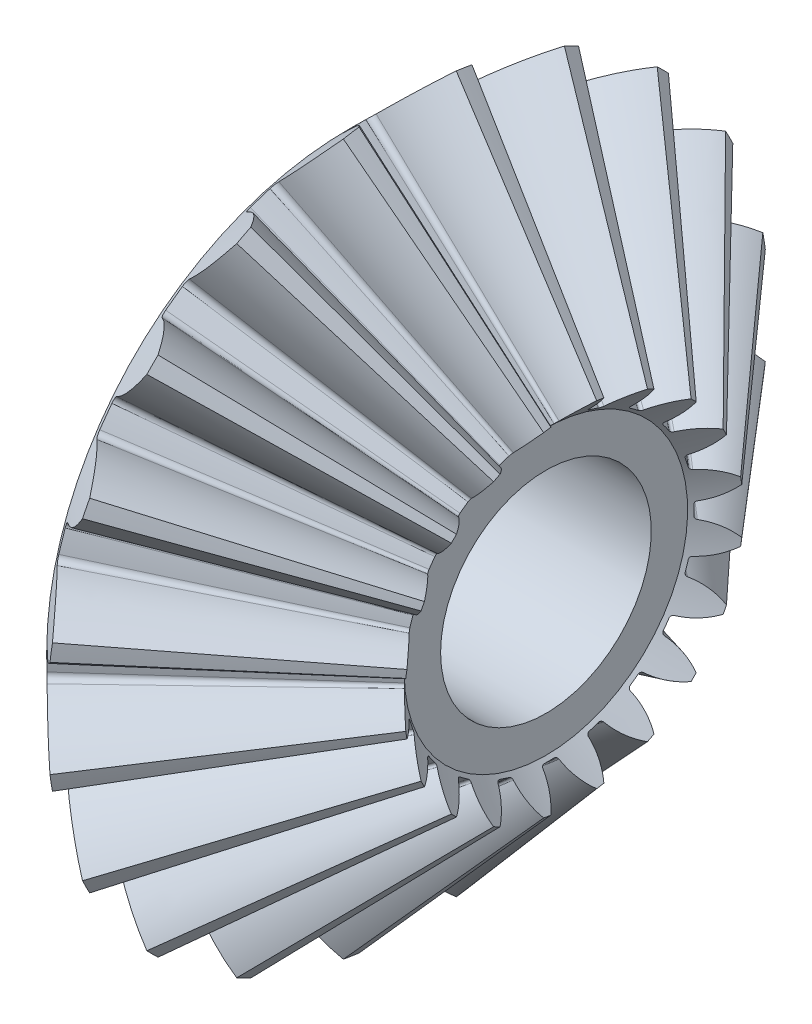
from build123d import *

# Parameters (mm, degrees)
TEETHCUTS_COUNT = 20
TEETHCUTS_ANGLE = 342
HUBSKE_R        = 5
HUB_DEPTH       = 0.0001016
BORSKE_R        = 2.5
BORE_DEPTH      = 8.84097754


with BuildPart() as part:
    # BasProSke → Base-Revolve (revolve)
    with BuildSketch(Plane(origin=(0, 0, 0), x_dir=(1, 0, 0), z_dir=(0, 1, 0)), mode=Mode.PRIVATE) as base_revolve_sk:
        Polygon((0, 0), (0, 7.159073261), (1.406612166, 8.565685424), (5.349252849, 4.023044734), (4.688609434, 3.36240132), (4.688609434, 0), align=None)
    revolve(base_revolve_sk.sketch.rotate(Axis((-10, 0, 0), (1, 0, 0)), 180), axis=Axis((-10, 0, 0), (1, 0, 0)))

    # ToothCut: read off the stored shape, not the designer's step
    # ToothCut: loft between two sections, ruled curve by curve
    toothcut_from = [
        Edge.make_bspline([(8.846968182, 0.006041442, -0.009396371), (8.842747294, 0.001820554, -0.014824058), (8.837070599, -0.003856141, -0.014022911), (8.833691402, -0.007235338, -0.007522631)], [0, 0, 0, 0, 1, 1, 1, 1], 3, [1, 0.779607321, 0.779607321, 1]),
        Edge.make_bspline([(8.833691402, -0.007235338, 0.007522631), (8.837070599, -0.003856141, 0.014022911), (8.842747294, 0.001820554, 0.014824058), (8.846968182, 0.006041442, 0.009396371)], [0, 0, 0, 0, 1, 1, 1, 1], 3, [1, 0.779607321, 0.779607321, 1]),
        Edge.make_bspline([(8.833691402, -0.007235338, -0.007522631), (8.833188772, -0.007737968, -0.006555763), (8.832787408, -0.008139332, -0.005498444), (8.832495307, -0.008431433, -0.00437174)], [0, 0, 0, 0, 1, 1, 1, 1], 3, [1, 0.993359051, 0.993359051, 1]),
        Edge.make_bspline([(8.832495307, -0.008431433, 0.00437174), (8.832787408, -0.008139332, 0.005498444), (8.833188772, -0.007737968, 0.006555763), (8.833691402, -0.007235338, 0.007522631)], [0, 0, 0, 0, 1, 1, 1, 1], 3, [1, 0.993359051, 0.993359051, 1]),
        Edge.make_bspline([(8.832495307, -0.008431433, -0.00437174), (8.831755763, -0.009170977, -0.001519142), (8.831755763, -0.009170977, 0.001519142), (8.832495307, -0.008431433, 0.00437174)], [0, 0, 0, 0, 1, 1, 1, 1], 3, [1, 0.959256539, 0.959256539, 1]),
        Edge.make_line((8.846968182, 0.006041442, 0.009396371), (8.846968182, 0.006041442, -0.009396371)),
    ]
    toothcut_to = [
        Edge.make_bspline([(1.46556069, 8.624633948, -1.28623016), (1.133128031, 8.29220129, -0.817842922), (0.716323315, 7.875396575, -0.512954078), (0.25391972, 7.412992981, -0.399925851)], [0, 0, 0, 0, 1, 1, 1, 1], 3, [1, 0.968991732, 0.968991732, 1]),
        Edge.make_bspline([(0.25391972, 7.412992981, 0.399925851), (0.716323315, 7.875396575, 0.512954078), (1.133128031, 8.29220129, 0.817842922), (1.46556069, 8.624633948, 1.28623016)], [0, 0, 0, 0, 1, 1, 1, 1], 3, [1, 0.968991732, 0.968991732, 1]),
        Edge.make_bspline([(0.25391972, 7.412992981, -0.399925851), (0.198607772, 7.357681033, -0.386405603), (0.16320738, 7.322280641, -0.324800046), (0.165162164, 7.324235425, -0.245465452)], [0, 0, 0, 0, 1, 1, 1, 1], 3, [1, 0.835749277, 0.835749277, 1]),
        Edge.make_bspline([(0.165162164, 7.324235425, 0.245465452), (0.16320738, 7.322280641, 0.324800046), (0.198607772, 7.357681033, 0.386405603), (0.25391972, 7.412992981, 0.399925851)], [0, 0, 0, 0, 1, 1, 1, 1], 3, [1, 0.835749277, 0.835749277, 1]),
        Edge.make_bspline([(0.165162164, 7.324235425, -0.245465452), (0.169193484, 7.328266745, -0.081854918), (0.169193484, 7.328266745, 0.081854918), (0.165162164, 7.324235425, 0.245465452)], [0, 0, 0, 0, 1, 1, 1, 1], 3, [1, 0.999595624, 0.999595624, 1]),
        Edge.make_line((1.46556069, 8.624633948, 1.28623016), (1.46556069, 8.624633948, -1.28623016)),
    ]
    toothcut = Solid(Shell([*[Face.make_surface_from_curves(toothcut_from[k], toothcut_to[k]) for k in range(6)], Face(Wire(toothcut_from)), Face(Wire(toothcut_to))]))
    add(toothcut, mode=Mode.SUBTRACT)

    # TeethCuts: ToothCut ×20 about axis
    teethcuts_axis = Axis((-10, 0, 0), (1, 0, 0))
    for i in range(1, TEETHCUTS_COUNT):
        add(toothcut.rotate(teethcuts_axis, i * TEETHCUTS_ANGLE / (TEETHCUTS_COUNT - 1)), mode=Mode.SUBTRACT)

    # HubSke → Hub (add)
    with BuildSketch(Plane.ZY):
        with Locations(Location((0, 0, 0), (0, 0, 180))):
            Circle(HUBSKE_R)
    extrude(amount=HUB_DEPTH)

    # BorSke → Bore (cut, symmetric)
    with BuildSketch(Plane(origin=(0, 0, 0), x_dir=(0, 0, -1), z_dir=(1, 0, 0))):
        with Locations(Location((0, 0, 0), (0, 0, 180))):
            Circle(BORSKE_R)
    extrude(amount=BORE_DEPTH, both=True, mode=Mode.SUBTRACT)


solid = part.part
